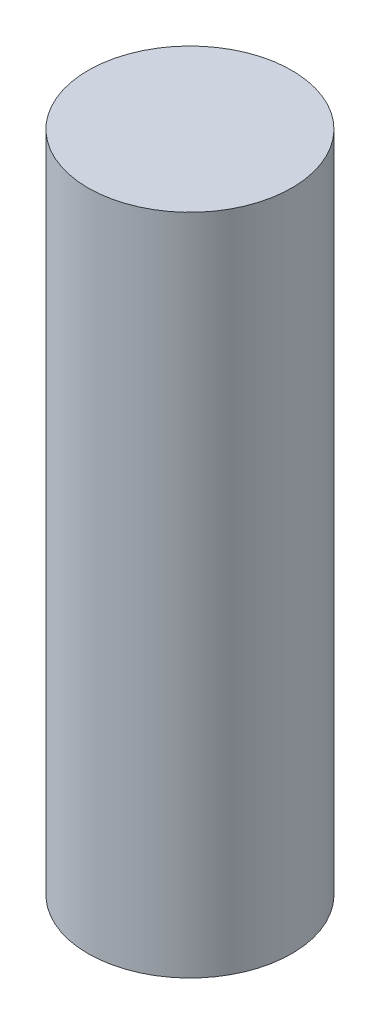
from build123d import *

# Parameters (mm, degrees)
SKETCH1_R           = 10.7749975
BOSS_EXTRUDE1_DEPTH = 70.149974


with BuildPart() as part:
    # Sketch1 → Boss-Extrude1 (new body)
    with BuildSketch(Plane(origin=(0, 0, 0), x_dir=(1, 0, 0), z_dir=(0, 1, 0))):
        Circle(SKETCH1_R)
    extrude(amount=BOSS_EXTRUDE1_DEPTH)


solid = part.part
